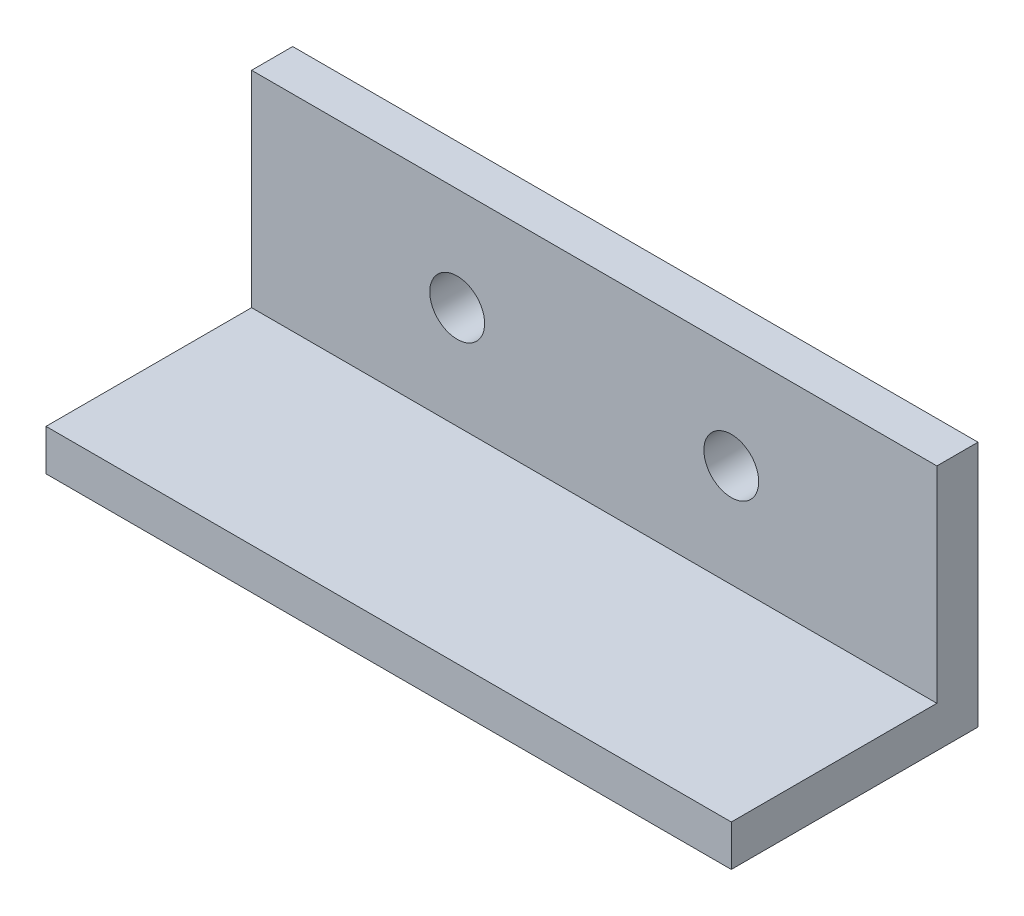
from build123d import *

# Parameters (mm, degrees)
SKETCH1_W           = 50
SKETCH1_H           = 15
BOSS_EXTRUDE1_DEPTH = 3
SKETCH2_W           = 50
SKETCH2_H           = 3
BOSS_EXTRUDE2_DEPTH = 18
SKETCH3_R           = 2
CUT_EXTRUDE1_DEPTH  = 3


with BuildPart() as part:
    # Sketch1 → Boss-Extrude1 (new body)
    with BuildSketch(Plane(origin=(0, 0, 0), x_dir=(1, 0, 0), z_dir=(0, 1, 0))):
        Rectangle(SKETCH1_W, SKETCH1_H)
    extrude(amount=BOSS_EXTRUDE1_DEPTH)

    # Sketch2 → Boss-Extrude2 (add)
    with BuildSketch(Plane.XZ):
        with Locations((0, -9)):
            Rectangle(SKETCH2_W, SKETCH2_H)
    extrude(amount=-BOSS_EXTRUDE2_DEPTH)

    # Sketch3 → Cut-Extrude1 (cut)
    with BuildSketch(Plane.XY.offset(-7.5)):
        with Locations((-10, 10.5)):
            Circle(SKETCH3_R)
        with Locations((10, 10.5)):
            Circle(SKETCH3_R)
    extrude(amount=-CUT_EXTRUDE1_DEPTH, mode=Mode.SUBTRACT)


solid = part.part
